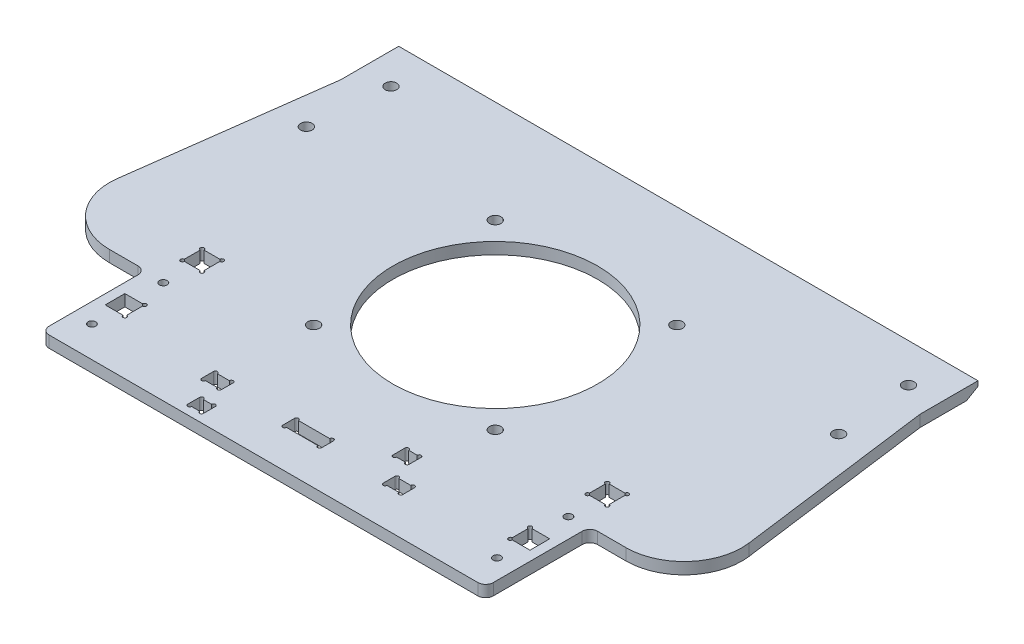
from build123d import *

# Parameters (mm, degrees)
SKETCH1_W           = 5.1
SKETCH1_H           = 5.1
BOSS_EXTRUDE1_DEPTH = 3
SKETCH2_R           = 26.5
SKETCH2_R_2         = 1.5
CUT_EXTRUDE1_DEPTH  = 3
FILLET1_R           = 15
SKETCH7_W           = 4.1
SKETCH7_H           = 3.1
SKETCH7_W_2         = 4.2
SKETCH7_W_3         = 5.1
SKETCH7_W_4         = 10.1
CUT_EXTRUDE4_DEPTH  = 10
CHAMFER1_SIZE       = 3
CHAMFER1_SIZE2      = 1.732050808
CUT_EXTRUDE5_DEPTH  = 10
SKETCH9_R           = 1
SKETCH9_R_2         = 1.5
CUT_EXTRUDE6_DEPTH  = 10
FILLET3_R           = 2


with BuildPart() as part:
    # Sketch1 → Boss-Extrude1 (new body)
    with BuildSketch(Plane(origin=(0, 0, 0), x_dir=(1, 0, 0), z_dir=(0, 1, 0))):
        Polygon((75, 95), (75, 110), (-75, 110), (-75, 95), (-84, 27), (-57.5, 27), (-57.5, 19.1), (-57.5, 14), (-57.5, 0), (57.5, 0), (57.5, 14), (57.5, 19.1), (57.5, 27), (84, 27), align=None)
        with Locations((52.45, 16.55)):
            Rectangle(SKETCH1_W, SKETCH1_H, mode=Mode.SUBTRACT)
        with Locations((52.45, 36.55)):
            Rectangle(SKETCH1_W, SKETCH1_H, mode=Mode.SUBTRACT)
        with Locations((-52.45, 16.55)):
            Rectangle(SKETCH1_W, SKETCH1_H, mode=Mode.SUBTRACT)
        with Locations((-52.45, 36.55)):
            Rectangle(SKETCH1_W, SKETCH1_H, mode=Mode.SUBTRACT)
    extrude(amount=BOSS_EXTRUDE1_DEPTH)

    # Sketch2 → Cut-Extrude1 (cut)
    with BuildSketch(Plane(origin=(0, 3, 0), x_dir=(1, 0, 0), z_dir=(0, 1, 0))):
        with Locations((0, 60)):
            Circle(SKETCH2_R)
        with Locations((23.511300474, 83.511300474)):
            Circle(SKETCH2_R_2)
        with Locations((-23.511300474, 83.511300474)):
            Circle(SKETCH2_R_2)
        with Locations((-23.511300474, 36.488699526)):
            Circle(SKETCH2_R_2)
        with Locations((23.511300474, 36.488699526)):
            Circle(SKETCH2_R_2)
    extrude(amount=-CUT_EXTRUDE1_DEPTH, mode=Mode.SUBTRACT)

    # Fillet1
    fillet1_edges = [part.edges().sort_by_distance(p)[0] for p in [
        (84, 1.5, -27),
        (-84, 1.5, -27),
    ]]
    fillet(fillet1_edges, radius=FILLET1_R)

    # Sketch7 → Cut-Extrude4 (cut)
    with BuildSketch(Plane.XZ):
        with Locations((-20, -3.95)):
            Rectangle(SKETCH7_W, SKETCH7_H)
        with Locations((18, -19.15)):
            Rectangle(SKETCH7_W_2, SKETCH7_H)
        with Locations((-23.5, -11.55)):
            Rectangle(SKETCH7_W_3, SKETCH7_H)
        with Locations((23.5, -11.55)):
            Rectangle(SKETCH7_W_3, SKETCH7_H)
        with Locations((0, -11.55)):
            Rectangle(SKETCH7_W_4, SKETCH7_H)
    extrude(amount=-CUT_EXTRUDE4_DEPTH, mode=Mode.SUBTRACT)

    # Chamfer1
    chamfer1_edges = [part.edges().sort_by_distance(p)[0] for p in [
        (0, 0, -110),
    ]]
    chamfer1_side = [part.faces().sort_by_distance(p)[0] for p in [
        (76.421351958, 0, -69.225215197),
    ]]
    chamfer(chamfer1_edges, length=CHAMFER1_SIZE, length2=CHAMFER1_SIZE2, reference=chamfer1_side[0])

    # Sketch4 → Cut-Extrude5 (cut)
    with BuildSketch(Plane(origin=(0, 3, 0), x_dir=(1, 0, 0), z_dir=(0, 1, 0))):
        with BuildLine():
            Line((49.9, 39.1), (50.4, 39.1))
            ThreePointArc((50.4, 39.1), (49.546446609, 39.453553391), (49.9, 38.6))
            Line((49.9, 38.6), (49.9, 39.1))
        make_face()
        with BuildLine():
            ThreePointArc((55, 38.6), (55.353553391, 39.453553391), (54.5, 39.1))
            Line((54.5, 39.1), (55, 39.1))
            Line((55, 39.1), (55, 38.6))
        make_face()
        with BuildLine():
            ThreePointArc((54.5, 34), (55.353553391, 33.646446609), (55, 34.5))
            Line((55, 34.5), (55, 34))
            Line((55, 34), (54.5, 34))
        make_face()
        with BuildLine():
            Line((49.9, 34), (49.9, 34.5))
            ThreePointArc((49.9, 34.5), (49.546446609, 33.646446609), (50.4, 34))
            Line((50.4, 34), (49.9, 34))
        make_face()
        with BuildLine():
            Line((50.4, 14), (49.967549047, 14))
            Line((49.967549047, 14), (49.9, 14))
            Line((49.9, 14), (49.9, 14.5))
            ThreePointArc((49.9, 14.5), (49.546446609, 13.646446609), (50.4, 14))
        make_face()
        with BuildLine():
            Line((49.9, 19.1), (50.4, 19.1))
            ThreePointArc((50.4, 19.1), (49.546446609, 19.453553391), (49.9, 18.6))
            Line((49.9, 18.6), (49.9, 19.1))
        make_face()
        with BuildLine():
            ThreePointArc((26.05, 13.1), (25.55, 13.6), (25.05, 13.1))
            Line((25.05, 13.1), (26.05, 13.1))
        make_face()
        with BuildLine():
            ThreePointArc((21.95, 13.1), (21.45, 13.6), (20.95, 13.1))
            Line((20.95, 13.1), (21.95, 13.1))
        make_face()
        with BuildLine():
            Line((21.95, 10), (20.95, 10))
            ThreePointArc((20.95, 10), (21.45, 9.5), (21.95, 10))
        make_face()
        with BuildLine():
            Line((26.05, 10), (25.05, 10))
            ThreePointArc((25.05, 10), (25.55, 9.5), (26.05, 10))
        make_face()
        with BuildLine():
            ThreePointArc((16.9, 20.7), (16.4, 21.2), (15.9, 20.7))
            Line((15.9, 20.7), (16.9, 20.7))
        make_face()
        with BuildLine():
            ThreePointArc((20.1, 20.7), (19.6, 21.2), (19.1, 20.7))
            Line((19.1, 20.7), (20.1, 20.7))
        make_face()
        with BuildLine():
            ThreePointArc((19.1, 17.6), (19.6, 17.1), (20.1, 17.6))
            Line((20.1, 17.6), (19.1, 17.6))
        make_face()
        with BuildLine():
            Line((16.9, 17.6), (15.9, 17.6))
            ThreePointArc((15.9, 17.6), (16.4, 17.1), (16.9, 17.6))
        make_face()
        with BuildLine():
            ThreePointArc((5.05, 13.1), (4.55, 13.6), (4.05, 13.1))
            Line((4.05, 13.1), (5.05, 13.1))
        make_face()
        with BuildLine():
            ThreePointArc((4.05, 10), (4.55, 9.5), (5.05, 10))
            Line((5.05, 10), (4.05, 10))
        make_face()
        with BuildLine():
            Line((-4.05, 10), (-5.05, 10))
            ThreePointArc((-5.05, 10), (-4.55, 9.5), (-4.05, 10))
        make_face()
        with BuildLine():
            Line((-5.05, 13.1), (-4.05, 13.1))
            ThreePointArc((-4.05, 13.1), (-4.55, 13.6), (-5.05, 13.1))
        make_face()
        with BuildLine():
            ThreePointArc((-21.05, 5.5), (-21.55, 6), (-22.05, 5.5))
            Line((-22.05, 5.5), (-21.05, 5.5))
        make_face()
        with BuildLine():
            ThreePointArc((-17.95, 5.5), (-18.45, 6), (-18.95, 5.5))
            Line((-18.95, 5.5), (-17.95, 5.5))
        make_face()
        with BuildLine():
            ThreePointArc((-18.95, 2.4), (-18.45, 1.9), (-17.95, 2.4))
            Line((-17.95, 2.4), (-18.95, 2.4))
        make_face()
        with BuildLine():
            Line((-21.05, 2.4), (-22.05, 2.4))
            ThreePointArc((-22.05, 2.4), (-21.55, 1.9), (-21.05, 2.4))
        make_face()
        with BuildLine():
            ThreePointArc((-26.05, 10), (-25.55, 9.5), (-25.05, 10))
            Line((-25.05, 10), (-26.05, 10))
        make_face()
        with BuildLine():
            ThreePointArc((-21.95, 10), (-21.45, 9.5), (-20.95, 10))
            Line((-20.95, 10), (-21.95, 10))
        make_face()
        with BuildLine():
            Line((-21.95, 13.1), (-20.95, 13.1))
            ThreePointArc((-20.95, 13.1), (-21.45, 13.6), (-21.95, 13.1))
        make_face()
        with BuildLine():
            Line((-26.05, 13.1), (-25.05, 13.1))
            ThreePointArc((-25.05, 13.1), (-25.55, 13.6), (-26.05, 13.1))
        make_face()
        with BuildLine():
            Line((-49.9, 14.5), (-49.9, 14))
            Line((-49.9, 14), (-49.967549047, 14))
            Line((-49.967549047, 14), (-50.4, 14))
            ThreePointArc((-50.4, 14), (-49.546446609, 13.646446609), (-49.9, 14.5))
        make_face()
        with BuildLine():
            Line((-49.9, 19.1), (-49.9, 18.6))
            ThreePointArc((-49.9, 18.6), (-49.546446609, 19.453553391), (-50.4, 19.1))
            Line((-50.4, 19.1), (-49.9, 19.1))
        make_face()
        with BuildLine():
            Line((-49.9, 34.5), (-49.9, 34))
            Line((-49.9, 34), (-50.4, 34))
            ThreePointArc((-50.4, 34), (-49.546446609, 33.646446609), (-49.9, 34.5))
        make_face()
        with BuildLine():
            Line((-54.5, 34), (-55, 34))
            Line((-55, 34), (-55, 34.5))
            ThreePointArc((-55, 34.5), (-55.353553391, 33.646446609), (-54.5, 34))
        make_face()
        with BuildLine():
            Line((-55, 38.6), (-55, 39.1))
            Line((-55, 39.1), (-54.5, 39.1))
            ThreePointArc((-54.5, 39.1), (-55.353553391, 39.453553391), (-55, 38.6))
        make_face()
        with BuildLine():
            Line((-50.4, 39.1), (-49.9, 39.1))
            Line((-49.9, 39.1), (-49.9, 38.6))
            ThreePointArc((-49.9, 38.6), (-49.546446609, 39.453553391), (-50.4, 39.1))
        make_face()
    extrude(amount=-CUT_EXTRUDE5_DEPTH, mode=Mode.SUBTRACT)

    # Sketch9 → Cut-Extrude6 (cut)
    with BuildSketch(Plane(origin=(0, 3, 0), x_dir=(1, 0, 0), z_dir=(0, 1, 0))):
        with Locations((52.45, 26.5)):
            Circle(SKETCH9_R)
        with Locations((52.45, 8)):
            Circle(SKETCH9_R)
        with Locations((67, 100)):
            Circle(SKETCH9_R_2)
        with Locations((68.915529111, 80)):
            Circle(SKETCH9_R_2)
        with Locations((-52.45, 8)):
            Circle(SKETCH9_R)
        with Locations((-52.45, 26.5)):
            Circle(SKETCH9_R)
        with Locations((-68.915529111, 80)):
            Circle(SKETCH9_R_2)
        with Locations((-67, 100)):
            Circle(SKETCH9_R_2)
    extrude(amount=-CUT_EXTRUDE6_DEPTH, mode=Mode.SUBTRACT)

    # Fillet3
    fillet3_edges = [part.edges().sort_by_distance(p)[0] for p in [
        (-57.5, 1.5, -27),
        (-57.5, 1.5, 0),
        (57.5, 1.5, 0),
        (57.5, 1.5, -27),
    ]]
    fillet(fillet3_edges, radius=FILLET3_R)


solid = part.part
